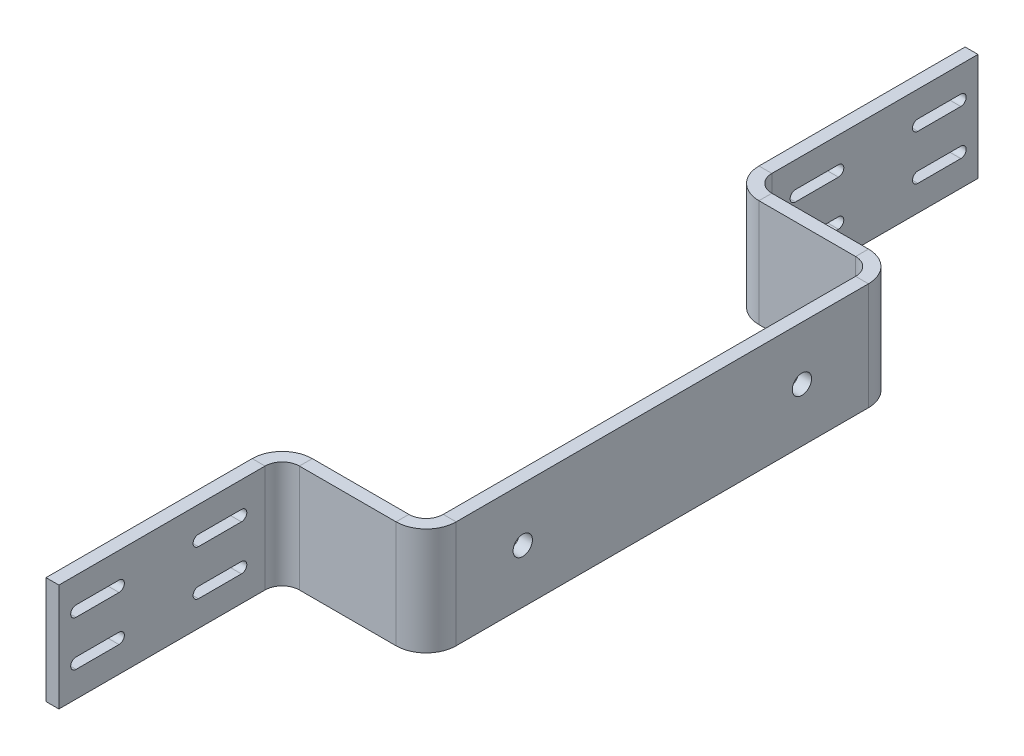
from build123d import *

# Parameters (mm, degrees)
SKETCH1_W                    = 110
SKETCH1_H                    = 50
BASE_FLANGE1_DEPTH           = 6
CUT_EXTRUDE1_DEPTH           = 10
LPATTERN1_COUNT              = 2
LPATTERN1_PITCH              = 57
MIRROR1_COPY_1_DEPTH         = 10
EDGE_FLANGE1_STRIP_W         = 40
EDGE_FLANGE1_STRIP_H         = 6
EDGE_FLANGE1_STRIP_CUT_DEPTH = 50
EDGE_FLANGE1_DEPTH           = 50
EDGE_FLANGE2_STRIP_W         = 40
EDGE_FLANGE2_STRIP_H         = 6
EDGE_FLANGE2_STRIP_CUT_DEPTH = 50
EDGE_FLANGE2_DEPTH           = 50
SKETCH9_R                    = 4.5
CUT_EXTRUDE2_DEPTH           = 10


# Sheet-metal steps are written as plain solids
with BuildPart() as part:
    # Sketch1 → Base-Flange1 (new body)
    with BuildSketch(Plane(origin=(0, 0, 0), x_dir=(0, 0, -1), z_dir=(1, 0, 0))):
        Rectangle(SKETCH1_W, SKETCH1_H)
    extrude(amount=-BASE_FLANGE1_DEPTH)

    # Sketch5 → Cut-Extrude1 (cut)
    with BuildSketch(Plane.ZY.offset(6)):
        with BuildLine():
            Line((-30, 13), (-10, 13))
            ThreePointArc((-10, 13), (-7.5, 10.5), (-10, 8))
            Line((-10, 8), (-30, 8))
            ThreePointArc((-30, 8), (-32.5, 10.5), (-30, 13))
        make_face()
    cut_extrude1 = extrude(amount=-CUT_EXTRUDE1_DEPTH, mode=Mode.SUBTRACT)

    # LPattern1: Cut-Extrude1 ×2
    with Locations(*[(0, 0, i * LPATTERN1_PITCH) for i in range(1, LPATTERN1_COUNT)]):
        add(cut_extrude1, mode=Mode.SUBTRACT)

    # Mirror1: Cut-Extrude1 across plane
    add(cut_extrude1.mirror(Plane.ZX), mode=Mode.SUBTRACT)

    # Mirror1 copy 1 sketch → Mirror1 copy 1 (cut)
    with BuildSketch(Plane(origin=(-6, 0, 57), x_dir=(0, 0, 1), z_dir=(-1, 0, 0))):
        with BuildLine():
            Line((-30, -13), (-10, -13))
            ThreePointArc((-10, -13), (-7.5, -10.5), (-10, -8))
            Line((-10, -8), (-30, -8))
            ThreePointArc((-30, -8), (-32.5, -10.5), (-30, -13))
        make_face()
    extrude(amount=-MIRROR1_COPY_1_DEPTH, mode=Mode.SUBTRACT)

    # Edge-Flange1 strip (across the edge) → Edge-Flange1 strip cut (cut)
    with BuildSketch(Plane(origin=(0, -25, -55), x_dir=(0, 0, 1), z_dir=(0, 1, 0))):
        with Locations((-6, -3)):
            Rectangle(EDGE_FLANGE1_STRIP_W, EDGE_FLANGE1_STRIP_H)
    extrude(amount=EDGE_FLANGE1_STRIP_CUT_DEPTH, mode=Mode.SUBTRACT)

    # Edge-Flange1 section (across the edge) → Edge-Flange1 (add)
    with BuildSketch(Plane(origin=(0, -25, -55), x_dir=(0, 0, 1), z_dir=(0, 1, 0))):
        with BuildLine():
            Line((0, 8), (0, 67))
            Line((0, 67), (6, 67))
            Line((6, 67), (6, 8))
            ThreePointArc((6, 8), (8.343145751, 2.343145751), (14, 0))
            Line((14, 0), (14, -6))
            ThreePointArc((14, -6), (4.100505063, -1.899494937), (0, 8))
        make_face()
    extrude(amount=EDGE_FLANGE1_DEPTH)

    # Edge-Flange2 strip (across the edge) → Edge-Flange2 strip cut (cut)
    with BuildSketch(Plane(origin=(67, 25, -55), x_dir=(-1, 0, 0), z_dir=(0, -1, 0))):
        with Locations((-6, -3)):
            Rectangle(EDGE_FLANGE2_STRIP_W, EDGE_FLANGE2_STRIP_H)
    extrude(amount=EDGE_FLANGE2_STRIP_CUT_DEPTH, mode=Mode.SUBTRACT)

    # Edge-Flange2 section (across the edge) → Edge-Flange2 (add)
    with BuildSketch(Plane(origin=(67, 25, -55), x_dir=(-1, 0, 0), z_dir=(0, -1, 0))):
        with BuildLine():
            Line((0, 8), (0, 104))
            Line((0, 104), (6, 104))
            Line((6, 104), (6, 8))
            ThreePointArc((6, 8), (8.343145751, 2.343145751), (14, 0))
            Line((14, 0), (14, -6))
            ThreePointArc((14, -6), (4.100505063, -1.899494937), (0, 8))
        make_face()
    extrude(amount=EDGE_FLANGE2_DEPTH)

    # Sketch9 → Cut-Extrude2 (cut)
    with BuildSketch(Plane.ZY.offset(-61)):
        with Locations((-94, 0)):
            Circle(SKETCH9_R)
    extrude(amount=-CUT_EXTRUDE2_DEPTH, mode=Mode.SUBTRACT)

    # Mirror2: part across plane


with BuildPart() as part_1:
    add(part.part)
    add(part.part.mirror(Plane(origin=(67, 25, -159), x_dir=(1, 0, 0), z_dir=(0, 0, 1))))


solid = part_1.part
